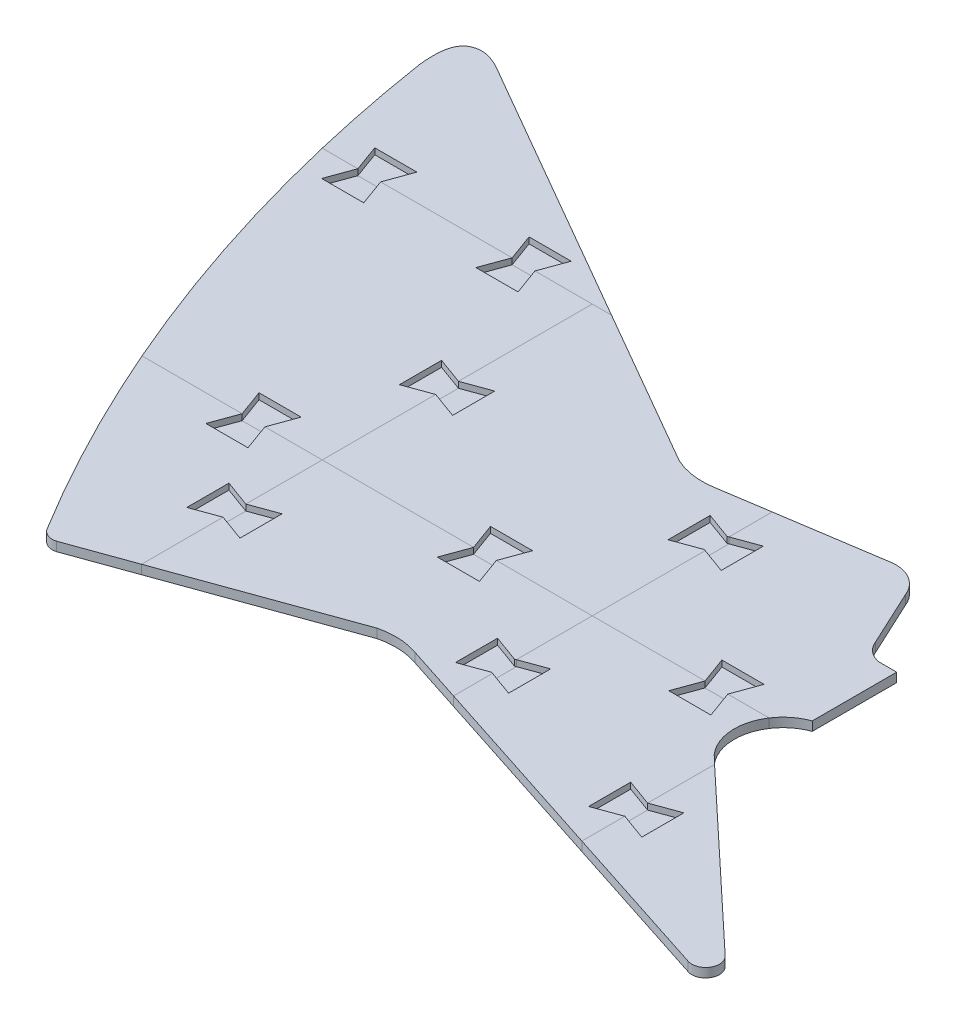
from build123d import *

# Parameters (mm, degrees)
BOSS_EXTRUDE1_DEPTH            = 40
F_13_0_13_DIAMETER_HOLE1_D     = 13
F_13_0_13_DIAMETER_HOLE1_DEPTH = 29
CUT_EXTRUDE8_DEPTH             = 16
SKETCH14_R                     = 6.35
SKETCH14_R_2                   = 5.502637429
CUT_EXTRUDE9_DEPTH             = 10
CUT_EXTRUDE10_DEPTH            = 10
BOSS_EXTRUDE2_DEPTH            = 24
BOSS_EXTRUDE3_START            = -40
BOSS_EXTRUDE3_DEPTH            = 40
CUT_EXTRUDE11_DEPTH            = 34
CUT_EXTRUDE12_START            = -672.787815527
CUT_EXTRUDE12_OUTLINE_W        = 473
CUT_EXTRUDE12_OUTLINE_H        = 6
CUT_EXTRUDE12_DEPTH            = 0.0001
CUT_EXTRUDE12_START_2          = -494.987815527
CUT_EXTRUDE12_2_OUTLINE_W      = 473
CUT_EXTRUDE12_2_OUTLINE_H      = 6
CUT_EXTRUDE12_2_DEPTH          = 0.0001
CUT_EXTRUDE13_START            = 253.822659289
CUT_EXTRUDE13_OUTLINE_W        = 6
CUT_EXTRUDE13_OUTLINE_H        = 27.629935764
CUT_EXTRUDE13_OUTLINE_H_2      = 46.868729155
CUT_EXTRUDE13_OUTLINE_H_3      = 44.459740095
CUT_EXTRUDE13_DEPTH            = 0.0001
CUT_EXTRUDE13_START_2          = 431.622659289
CUT_EXTRUDE13_2_OUTLINE_W      = 6
CUT_EXTRUDE13_2_OUTLINE_H      = 46.868729155
CUT_EXTRUDE13_2_OUTLINE_H_2    = 44.459740095
CUT_EXTRUDE13_2_DEPTH          = 0.0001
CUT_EXTRUDE13_START_3          = 556.622559289
CUT_EXTRUDE13_3_OUTLINE_W      = 6
CUT_EXTRUDE13_3_OUTLINE_H      = 87.376935067
CUT_EXTRUDE13_3_DEPTH          = 0.0001
CUT_EXTRUDE14_DEPTH            = 4


# Read off the part's stored shape, not the designer's step: Cut-Extrude12, Cut-Extrude13
with BuildPart() as part:
    # Sketch1 → Boss-Extrude1 (new body)
    with BuildSketch(Plane(origin=(0, 20, 0), x_dir=(1, 0, 0), z_dir=(0, 1, 0))):
        with BuildLine():
            Line((563.96485174, 507.513718698), (563.96485174, 562.736423486))
            Line((563.96485174, 562.736423486), (554.690781869, 562.894803628))
            ThreePointArc((554.690781869, 562.894803628), (545.704943994, 565.795150829), (539.853906856, 573.206133263))
            Line((539.853906856, 573.206133263), (522.524343645, 610.429990226))
            ThreePointArc((522.524343645, 610.429990226), (512.649800976, 621.543175495), (497.931198247, 623.634159339))
            Line((497.931198247, 623.634159339), (399.830947056, 608.608698386))
            ThreePointArc((399.830947056, 608.608698386), (385.610832142, 608.137408426), (371.923585817, 612.02238853))
            Line((371.923585817, 612.02238853), (95.310746964, 771.494097008))
            add(Edge.make_bspline(
                [(60.287007155, 752.902507236), (59.408683029, 762.769524202), (58.560960325, 776.204376236), (76.94287295, 783.298520304), (86.753146937, 776.493697586), (95.310746964, 771.494097008)],
                knots=[0, 0, 0, 0, 0.5, 0.5, 1, 1, 1, 1], degree=3))
            ThreePointArc((60.287007155, 752.902507236), (112.407005996, 551.803928099), (202.762947005, 364.739937083))
            ThreePointArc((202.762947005, 364.739937083), (207.132055784, 361.391783138), (212.632195034, 361.173346422))
            Line((212.632195034, 361.173346422), (367.65464082, 417.084401042))
            ThreePointArc((367.65464082, 417.084401042), (380.966681082, 418.419109504), (394.090964942, 415.82198883))
            Line((394.090964942, 415.82198883), (660.231475403, 329.574923038))
            ThreePointArc((660.231475403, 329.574923038), (670.878462163, 333.606992627), (669.266978502, 344.877264703))
            Line((669.266978502, 344.877264703), (553.73117364, 453.239940989))
            ThreePointArc((553.73117364, 453.239940989), (543.342125743, 483.300566911), (563.96485174, 507.513718698))
        make_face()
    extrude(amount=-BOSS_EXTRUDE1_DEPTH)

    # Ø13.0 (13) Diameter Hole1
    with Locations(Plane(origin=(0, 20, 0), x_dir=(1, 0, 0), z_dir=(0, 1, 0))):
        with Locations((274.335910331, 496.233480955), (274.335910331, 579.213058938)):
            Hole(F_13_0_13_DIAMETER_HOLE1_D / 2, depth=F_13_0_13_DIAMETER_HOLE1_DEPTH)

    # Sketch13 → Cut-Extrude8 (cut)
    with BuildSketch(Plane(origin=(0, 20, 0), x_dir=(1, 0, 0), z_dir=(0, 1, 0))):
        with BuildLine():
            Line((563.96485174, 563.125071092), (496.273234513, 563.125071092))
            ThreePointArc((496.273234513, 563.125071092), (492.20587406, 561.651450789), (490.026307291, 557.914544776))
            ThreePointArc((490.026307291, 557.914544776), (487.96485174, 535.125071092), (490.026307291, 512.335597408))
            ThreePointArc((490.026307291, 512.335597408), (492.20587406, 508.598691395), (496.273234513, 507.125071092))
            Line((496.273234513, 507.125071092), (563.96485174, 507.125071092))
            Line((563.96485174, 507.125071092), (563.96485174, 563.125071092))
        make_face()
    extrude(amount=-CUT_EXTRUDE8_DEPTH, mode=Mode.SUBTRACT)

    # Sketch14 → Cut-Extrude9 (cut)
    with BuildSketch(Plane(origin=(0, 20, 0), x_dir=(1, 0, 0), z_dir=(0, 1, 0))):
        with Locations(Location((303.81485174, 498.131405852, 0), (0, 0, 270))):
            Circle(SKETCH14_R)
        with Locations(Location((298.641153596, 572.118736332, 0), (0, 0, 270))):
            Circle(SKETCH14_R_2)
    extrude(amount=-CUT_EXTRUDE9_DEPTH, mode=Mode.SUBTRACT)

    # Sketch17 → Cut-Extrude10 (cut)
    with BuildSketch(Plane(origin=(0, 20, 0), x_dir=(1, 0, 0), z_dir=(0, 1, 0))):
        with BuildLine():
            Line((481.61485174, 499.042173829), (481.61485174, 571.207968354))
            ThreePointArc((481.61485174, 571.207968354), (473.296544122, 580.314612527), (463.475969831, 572.852606745))
            Line((463.475969831, 572.852606745), (457.73885174, 541.475071092))
            Line((457.73885174, 541.475071092), (457.73885174, 528.775071092))
            Line((457.73885174, 528.775071092), (463.475969831, 497.397535439))
            ThreePointArc((463.475969831, 497.397535439), (473.296544122, 489.935529657), (481.61485174, 499.042173829))
        make_face()
        with BuildLine():
            Line((420.65485174, 499.042173829), (420.65485174, 571.207968354))
            ThreePointArc((420.65485174, 571.207968354), (412.336544122, 580.314612527), (402.515969831, 572.852606745))
            Line((402.515969831, 572.852606745), (396.77885174, 541.475071092))
            Line((396.77885174, 541.475071092), (396.77885174, 528.775071092))
            Line((396.77885174, 528.775071092), (402.515969831, 497.397535439))
            ThreePointArc((402.515969831, 497.397535439), (412.336544122, 489.935529657), (420.65485174, 499.042173829))
        make_face()
        with BuildLine():
            Line((357.072977222, 497.929527206), (372.077089581, 568.518325976))
            ThreePointArc((372.077089581, 568.518325976), (365.83393473, 579.155441526), (354.67652531, 573.898310679))
            Line((354.67652531, 573.898310679), (342.541020523, 544.399263386))
            Line((342.541020523, 544.399263386), (339.90054205, 531.976788856))
            Line((339.90054205, 531.976788856), (338.988533854, 500.092113718))
            ThreePointArc((338.988533854, 500.092113718), (347.043066796, 490.751358459), (357.072977222, 497.929527206))
        make_face()
    extrude(amount=-CUT_EXTRUDE10_DEPTH, mode=Mode.SUBTRACT)

    # Sketch19 → Boss-Extrude2 (add)
    with BuildSketch(Plane(origin=(0, 4, 0), x_dir=(1, 0, 0), z_dir=(0, 1, 0))):
        with BuildLine():
            Line((552.229738554, 563.125071092), (563.96485174, 563.125071092))
            Line((563.96485174, 563.125071092), (563.96485174, 562.736423486))
            Line((563.96485174, 562.736423486), (554.690781869, 562.894803628))
            ThreePointArc((554.690781869, 562.894803628), (553.455870496, 562.963021133), (552.229738554, 563.125071092))
        make_face()
    extrude(amount=-BOSS_EXTRUDE2_DEPTH)

    # Sketch20 → Boss-Extrude3 (add)
    with BuildSketch(Plane.XZ.offset(20).offset(BOSS_EXTRUDE3_START)):
        with BuildLine():
            Line((553.73117364, -453.239940989), (669.266978502, -344.877264703))
            ThreePointArc((669.266978502, -344.877264703), (670.878462163, -333.606992627), (660.231475403, -329.574923038))
            Line((660.231475403, -329.574923038), (394.090964942, -415.82198883))
            ThreePointArc((394.090964942, -415.82198883), (380.966681082, -418.419109504), (367.65464082, -417.084401042))
            Line((367.65464082, -417.084401042), (212.632195034, -361.173346422))
            ThreePointArc((212.632195034, -361.173346422), (207.132055784, -361.391783138), (202.762947005, -364.739937083))
            ThreePointArc((202.762947005, -364.739937083), (112.407005996, -551.803928099), (60.287007155, -752.902507236))
            add(Edge.make_bspline(
                [(60.287007155, -752.902507236), (59.408683029, -762.769524202), (58.560960325, -776.204376236), (76.94287295, -783.298520304), (86.753146937, -776.493697586), (95.310746964, -771.494097008)],
                knots=[0, 0, 0, 0, 0.5, 0.5, 1, 1, 1, 1], degree=3))
            Line((95.310746964, -771.494097008), (371.923585817, -612.02238853))
            ThreePointArc((371.923585817, -612.02238853), (385.610832142, -608.137408426), (399.830947056, -608.608698386))
            Line((399.830947056, -608.608698386), (497.931198247, -623.634159339))
            ThreePointArc((497.931198247, -623.634159339), (512.649800976, -621.543175495), (522.524343645, -610.429990226))
            Line((522.524343645, -610.429990226), (539.853906856, -573.206133263))
            ThreePointArc((539.853906856, -573.206133263), (544.716962334, -566.539161561), (552.229738554, -563.125071092))
            Line((552.229738554, -563.125071092), (563.96485174, -563.125071092))
            Line((563.96485174, -563.125071092), (563.96485174, -507.513718698))
            ThreePointArc((563.96485174, -507.513718698), (543.342125743, -483.300566911), (553.73117364, -453.239940989))
        make_face()
    extrude(amount=BOSS_EXTRUDE3_DEPTH)

    # Sketch21 → Cut-Extrude11 (cut)
    with BuildSketch(Plane(origin=(0, 20, 0), x_dir=(1, 0, 0), z_dir=(0, 1, 0))):
        with BuildLine():
            Line((563.96485174, 507.513718698), (563.96485174, 563.125071092))
            Line((563.96485174, 563.125071092), (552.229738554, 563.125071092))
            ThreePointArc((552.229738554, 563.125071092), (544.716962334, 566.539161561), (539.853906856, 573.206133263))
            Line((539.853906856, 573.206133263), (522.524343645, 610.429990226))
            ThreePointArc((522.524343645, 610.429990226), (512.649800976, 621.543175495), (497.931198247, 623.634159339))
            Line((497.931198247, 623.634159339), (399.830947056, 608.608698386))
            ThreePointArc((399.830947056, 608.608698386), (385.610832142, 608.137408426), (371.923585817, 612.02238853))
            Line((371.923585817, 612.02238853), (95.310746964, 771.494097008))
            add(Edge.make_bspline(
                [(95.310746964, 771.494097008), (86.753146937, 776.493697586), (76.94287295, 783.298520304), (58.560960325, 776.204376236), (59.408683029, 762.769524202), (60.287007155, 752.902507236)],
                knots=[0, 0, 0, 0, 0.5, 0.5, 1, 1, 1, 1], degree=3))
            ThreePointArc((60.287007155, 752.902507236), (112.407005996, 551.803928099), (202.762947005, 364.739937083))
            ThreePointArc((202.762947005, 364.739937083), (207.132055784, 361.391783138), (212.632195034, 361.173346422))
            Line((212.632195034, 361.173346422), (367.65464082, 417.084401042))
            ThreePointArc((367.65464082, 417.084401042), (380.966681082, 418.419109504), (394.090964942, 415.82198883))
            Line((394.090964942, 415.82198883), (660.231475403, 329.574923038))
            ThreePointArc((660.231475403, 329.574923038), (670.878462163, 333.606992627), (669.266978502, 344.877264703))
            Line((669.266978502, 344.877264703), (553.73117364, 453.239940989))
            ThreePointArc((553.73117364, 453.239940989), (543.342125743, 483.300566911), (563.96485174, 507.513718698))
        make_face()
    extrude(amount=-CUT_EXTRUDE11_DEPTH, mode=Mode.SUBTRACT)

    # Cut-Extrude12 outline → Cut-Extrude12 (cut)
    with BuildSketch(Plane.XY.offset(CUT_EXTRUDE12_START)):
        with Locations((312.5, -17)):
            Rectangle(CUT_EXTRUDE12_OUTLINE_W, CUT_EXTRUDE12_OUTLINE_H)
    extrude(amount=CUT_EXTRUDE12_DEPTH, mode=Mode.SUBTRACT)

    # Cut-Extrude12 2 outline → Cut-Extrude12 2 (cut)
    with BuildSketch(Plane.XY.offset(CUT_EXTRUDE12_START_2)):
        with Locations((312.5, -17)):
            Rectangle(CUT_EXTRUDE12_2_OUTLINE_W, CUT_EXTRUDE12_2_OUTLINE_H)
    extrude(amount=CUT_EXTRUDE12_2_DEPTH, mode=Mode.SUBTRACT)

    # Cut-Extrude13 outline → Cut-Extrude13 (cut)
    with BuildSketch(Plane.YZ.offset(CUT_EXTRUDE13_START)):
        with Locations((-17, -389.844278395)):
            Rectangle(CUT_EXTRUDE13_OUTLINE_W, CUT_EXTRUDE13_OUTLINE_H)
        with Locations((-17, -427.093610855)):
            Rectangle(CUT_EXTRUDE13_OUTLINE_W, CUT_EXTRUDE13_OUTLINE_H_2)
        with Locations((-17, -472.75784548)):
            Rectangle(CUT_EXTRUDE13_OUTLINE_W, CUT_EXTRUDE13_OUTLINE_H_3)
        Polygon((-14, -613.478055243), (-14, -494.987815527), (-20, -494.987715527), (-20, -613.478055243), align=None)
        Polygon((-14, -624.110525751), (-14, -613.478055243), (-20, -613.478055243), (-20, -624.110525751), (-20, -672.787715527), (-14, -672.787715527), align=None)
    extrude(amount=CUT_EXTRUDE13_DEPTH, mode=Mode.SUBTRACT)

    # Cut-Extrude13 2 outline → Cut-Extrude13 2 (cut)
    with BuildSketch(Plane.YZ.offset(CUT_EXTRUDE13_START_2)):
        with Locations((-17, -427.093610855)):
            Rectangle(CUT_EXTRUDE13_2_OUTLINE_W, CUT_EXTRUDE13_2_OUTLINE_H)
        with Locations((-17, -472.75784548)):
            Rectangle(CUT_EXTRUDE13_2_OUTLINE_W, CUT_EXTRUDE13_2_OUTLINE_H_2)
        Polygon((-14, -613.478055243), (-14, -494.987815527), (-20, -494.987715527), (-20, -613.478055243), align=None)
    extrude(amount=CUT_EXTRUDE13_2_DEPTH, mode=Mode.SUBTRACT)

    # Cut-Extrude13 3 outline → Cut-Extrude13 3 (cut)
    with BuildSketch(Plane.YZ.offset(CUT_EXTRUDE13_START_3)):
        with Locations((-17, -406.839507899)):
            Rectangle(CUT_EXTRUDE13_3_OUTLINE_W, CUT_EXTRUDE13_3_OUTLINE_H)
    extrude(amount=CUT_EXTRUDE13_3_DEPTH, mode=Mode.SUBTRACT)

    # Sketch27 → Cut-Extrude14 (cut)
    with BuildSketch(Plane(origin=(0, -14, 0), x_dir=(1, 0, 0), z_dir=(0, 1, 0))):
        Polygon((194.71002043, 690.287715527), (222.448978629, 690.287715527), (216.079499529, 672.787715527), (222.448978629, 655.287715527), (194.71002043, 655.287715527), (201.079499529, 672.787715527), align=None)
        Polygon((99.479499529, 672.787715527), (93.11002043, 690.287715527), (120.848978629, 690.287715527), (114.479499529, 672.787715527), (120.848978629, 655.287715527), (93.11002043, 655.287715527), align=None)
        Polygon((201.079499529, 494.987715527), (194.71002043, 512.487715527), (222.448978629, 512.487715527), (216.079499529, 494.987715527), (222.448978629, 477.487715527), (194.71002043, 477.487715527), align=None)
        Polygon((353.479499529, 494.987715527), (347.11002043, 512.487715527), (374.848978629, 512.487715527), (368.479499529, 494.987715527), (374.848978629, 477.487715527), (347.11002043, 477.487715527), align=None)
        Polygon((505.879499529, 494.987715527), (499.51002043, 512.487715527), (527.248978629, 512.487715527), (520.879499529, 494.987715527), (527.248978629, 477.487715527), (499.51002043, 477.487715527), align=None)
        Polygon((271.322759289, 591.06039229), (271.322759289, 563.321434091), (253.822759289, 569.690913191), (236.322759289, 563.321434091), (236.322759289, 591.06039229), (253.822759289, 584.690913191), align=None)
        Polygon((253.822759289, 444.690913191), (271.322759289, 451.06039229), (271.322759289, 423.321434091), (253.822759289, 429.690913191), (236.322759289, 423.321434091), (236.322759289, 451.06039229), align=None)
        Polygon((430.693175696, 444.690913191), (448.193175696, 451.06039229), (448.193175696, 423.321434091), (430.693175696, 429.690913191), (413.193175696, 423.321434091), (413.193175696, 451.06039229), align=None)
        Polygon((430.693175696, 584.690913191), (448.193175696, 591.06039229), (448.193175696, 563.321434091), (430.693175696, 569.690913191), (413.193175696, 563.321434091), (413.193175696, 591.06039229), align=None)
        Polygon((574.122659289, 412.817458901), (574.122659289, 385.078500701), (556.622659289, 391.447979801), (539.122659289, 385.078500701), (539.122659289, 412.817458901), (556.622659289, 406.447979801), align=None)
    extrude(amount=-CUT_EXTRUDE14_DEPTH, mode=Mode.SUBTRACT)


solid = part.part
